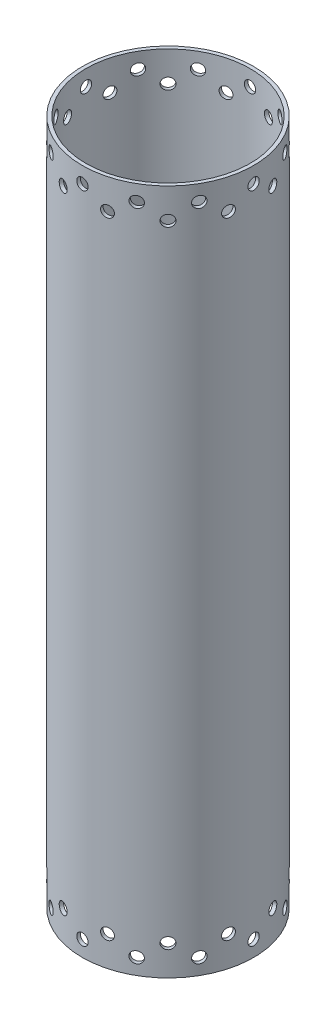
from build123d import *

# Parameters (mm, degrees)
SKETCH2_R                = 76.2
SKETCH2_R_2              = 73.025
BOSS_EXTRUDE1_DEPTH      = 609.6
SKETCH3_R                = 5.0419
CUT_EXTRUDE1_DEPTH       = 1143
SKETCH6_R                = 5.0419
CUT_EXTRUDE2_DEPTH       = 25.4
CIRPATTERN2_COUNT        = 12
MIRROR1_COPY_1_SKETCH_R  = 5.0419
MIRROR1_COPY_1_DEPTH     = 1143
MIRROR1_COPY_2_SKETCH_R  = 5.0419
MIRROR1_COPY_2_DEPTH     = 1143
MIRROR1_COPY_3_SKETCH_R  = 5.0419
MIRROR1_COPY_3_DEPTH     = 1143
MIRROR1_COPY_4_SKETCH_R  = 5.0419
MIRROR1_COPY_4_DEPTH     = 1143
MIRROR1_COPY_5_SKETCH_R  = 5.0419
MIRROR1_COPY_5_DEPTH     = 1143
MIRROR1_COPY_6_SKETCH_R  = 5.0419
MIRROR1_COPY_6_DEPTH     = 1143
MIRROR1_COPY_7_SKETCH_R  = 5.0419
MIRROR1_COPY_7_DEPTH     = 1143
MIRROR1_COPY_8_SKETCH_R  = 5.0419
MIRROR1_COPY_8_DEPTH     = 1143
MIRROR1_COPY_9_SKETCH_R  = 5.0419
MIRROR1_COPY_9_DEPTH     = 1143
MIRROR1_COPY_10_SKETCH_R = 5.0419
MIRROR1_COPY_10_DEPTH    = 1143
MIRROR1_COPY_11_SKETCH_R = 5.0419
MIRROR1_COPY_11_DEPTH    = 1143
MIRROR1_COPY_12_SKETCH_R = 5.0419
MIRROR1_COPY_12_DEPTH    = 25.4
MIRROR1_COPY_13_SKETCH_R = 5.0419
MIRROR1_COPY_13_DEPTH    = 25.4
MIRROR1_COPY_14_SKETCH_R = 5.0419
MIRROR1_COPY_14_DEPTH    = 25.4
MIRROR1_COPY_15_SKETCH_R = 5.0419
MIRROR1_COPY_15_DEPTH    = 25.4
MIRROR1_COPY_16_SKETCH_R = 5.0419
MIRROR1_COPY_16_DEPTH    = 25.4
MIRROR1_COPY_17_SKETCH_R = 5.0419
MIRROR1_COPY_17_DEPTH    = 25.4
MIRROR1_COPY_18_SKETCH_R = 5.0419
MIRROR1_COPY_18_DEPTH    = 25.4
MIRROR1_COPY_19_SKETCH_R = 5.0419
MIRROR1_COPY_19_DEPTH    = 25.4
MIRROR1_COPY_20_SKETCH_R = 5.0419
MIRROR1_COPY_20_DEPTH    = 25.4
MIRROR1_COPY_21_SKETCH_R = 5.0419
MIRROR1_COPY_21_DEPTH    = 25.4
MIRROR1_COPY_22_SKETCH_R = 5.0419
MIRROR1_COPY_22_DEPTH    = 25.4
MIRROR1_COPY_23_SKETCH_R = 5.0419
MIRROR1_COPY_23_DEPTH    = 1143
MIRROR1_COPY_24_SKETCH_R = 5.0419
MIRROR1_COPY_24_DEPTH    = 25.4


with BuildPart() as part:
    # Sketch2 → Boss-Extrude1 (new body)
    with BuildSketch(Plane(origin=(0, 0, 0), x_dir=(1, 0, 0), z_dir=(0, 1, 0))):
        Circle(SKETCH2_R)
        Circle(SKETCH2_R_2, mode=Mode.SUBTRACT)
    extrude(amount=BOSS_EXTRUDE1_DEPTH)

    # Sketch3 → Cut-Extrude1 (cut)
    with BuildSketch(Plane.XY):
        with Locations((0, 595.503)):
            Circle(SKETCH3_R)
    cut_extrude1 = extrude(amount=-CUT_EXTRUDE1_DEPTH, mode=Mode.SUBTRACT)

    # Sketch6 → Cut-Extrude2 (cut)
    with BuildSketch(Plane(origin=(-19.722011237, 0, 73.603547963), x_dir=(0, -1, 0), z_dir=(-0.25881904510252135, 0, 0.9659258262890681))):
        with Locations((-582.803, 0)):
            Circle(SKETCH6_R)
    cut_extrude2 = extrude(amount=-CUT_EXTRUDE2_DEPTH, mode=Mode.SUBTRACT)

    # CirPattern2: Cut-Extrude1, Cut-Extrude2 ×12 about axis
    cirpattern2_axis = Axis((0, 609.6, 0), (0, -1, 0))
    add([cut_extrude1.rotate(cirpattern2_axis, i * 360 / CIRPATTERN2_COUNT) for i in range(1, CIRPATTERN2_COUNT)], mode=Mode.SUBTRACT)
    add([cut_extrude2.rotate(cirpattern2_axis, i * 360 / CIRPATTERN2_COUNT) for i in range(1, CIRPATTERN2_COUNT)], mode=Mode.SUBTRACT)

    # Mirror1 copy 1 sketch → Mirror1 copy 1 (cut)
    with BuildSketch(Plane(origin=(0, 609.6, 0), x_dir=(0.8660254037844387, 0, 0.49999999999999994), z_dir=(-0.49999999999999994, 0, 0.8660254037844387))):
        with Locations((0, -595.503)):
            Circle(MIRROR1_COPY_1_SKETCH_R)
    extrude(amount=-MIRROR1_COPY_1_DEPTH, mode=Mode.SUBTRACT)

    # Mirror1 copy 2 sketch → Mirror1 copy 2 (cut)
    with BuildSketch(Plane(origin=(0, 609.6, 0), x_dir=(0.5000000000000001, 0, 0.8660254037844386), z_dir=(-0.8660254037844386, 0, 0.5000000000000001))):
        with Locations((0, -595.503)):
            Circle(MIRROR1_COPY_2_SKETCH_R)
    extrude(amount=-MIRROR1_COPY_2_DEPTH, mode=Mode.SUBTRACT)

    # Mirror1 copy 3 sketch → Mirror1 copy 3 (cut)
    with BuildSketch(Plane(origin=(0, 609.6, 0), x_dir=(0, 0, 1), z_dir=(-1, 0, 0))):
        with Locations((0, -595.503)):
            Circle(MIRROR1_COPY_3_SKETCH_R)
    extrude(amount=-MIRROR1_COPY_3_DEPTH, mode=Mode.SUBTRACT)

    # Mirror1 copy 4 sketch → Mirror1 copy 4 (cut)
    with BuildSketch(Plane(origin=(0, 609.6, 0), x_dir=(-0.4999999999999998, 0, 0.8660254037844387), z_dir=(-0.8660254037844387, 0, -0.4999999999999998))):
        with Locations((0, -595.503)):
            Circle(MIRROR1_COPY_4_SKETCH_R)
    extrude(amount=-MIRROR1_COPY_4_DEPTH, mode=Mode.SUBTRACT)

    # Mirror1 copy 5 sketch → Mirror1 copy 5 (cut)
    with BuildSketch(Plane(origin=(0, 609.6, 0), x_dir=(-0.8660254037844387, 0, 0.49999999999999994), z_dir=(-0.49999999999999994, 0, -0.8660254037844387))):
        with Locations((0, -595.503)):
            Circle(MIRROR1_COPY_5_SKETCH_R)
    extrude(amount=-MIRROR1_COPY_5_DEPTH, mode=Mode.SUBTRACT)

    # Mirror1 copy 6 sketch → Mirror1 copy 6 (cut)
    with BuildSketch(Plane(origin=(0, 609.6, 0), x_dir=(-1, 0, 0), z_dir=(0, 0, -1))):
        with Locations((0, -595.503)):
            Circle(MIRROR1_COPY_6_SKETCH_R)
    extrude(amount=-MIRROR1_COPY_6_DEPTH, mode=Mode.SUBTRACT)

    # Mirror1 copy 7 sketch → Mirror1 copy 7 (cut)
    with BuildSketch(Plane(origin=(0, 609.6, 0), x_dir=(-0.8660254037844386, 0, -0.5000000000000001), z_dir=(0.5000000000000001, 0, -0.8660254037844386))):
        with Locations((0, -595.503)):
            Circle(MIRROR1_COPY_7_SKETCH_R)
    extrude(amount=-MIRROR1_COPY_7_DEPTH, mode=Mode.SUBTRACT)

    # Mirror1 copy 8 sketch → Mirror1 copy 8 (cut)
    with BuildSketch(Plane(origin=(0, 609.6, 0), x_dir=(-0.5000000000000004, 0, -0.8660254037844384), z_dir=(0.8660254037844384, 0, -0.5000000000000004))):
        with Locations((0, -595.503)):
            Circle(MIRROR1_COPY_8_SKETCH_R)
    extrude(amount=-MIRROR1_COPY_8_DEPTH, mode=Mode.SUBTRACT)

    # Mirror1 copy 9 sketch → Mirror1 copy 9 (cut)
    with BuildSketch(Plane(origin=(0, 609.6, 0), x_dir=(0, 0, -1), z_dir=(1, 0, 0))):
        with Locations((0, -595.503)):
            Circle(MIRROR1_COPY_9_SKETCH_R)
    extrude(amount=-MIRROR1_COPY_9_DEPTH, mode=Mode.SUBTRACT)

    # Mirror1 copy 10 sketch → Mirror1 copy 10 (cut)
    with BuildSketch(Plane(origin=(0, 609.6, 0), x_dir=(0.5000000000000001, 0, -0.8660254037844386), z_dir=(0.8660254037844386, 0, 0.5000000000000001))):
        with Locations((0, -595.503)):
            Circle(MIRROR1_COPY_10_SKETCH_R)
    extrude(amount=-MIRROR1_COPY_10_DEPTH, mode=Mode.SUBTRACT)

    # Mirror1 copy 11 sketch → Mirror1 copy 11 (cut)
    with BuildSketch(Plane(origin=(0, 609.6, 0), x_dir=(0.8660254037844384, 0, -0.5000000000000004), z_dir=(0.5000000000000004, 0, 0.8660254037844384))):
        with Locations((0, -595.503)):
            Circle(MIRROR1_COPY_11_SKETCH_R)
    extrude(amount=-MIRROR1_COPY_11_DEPTH, mode=Mode.SUBTRACT)

    # Mirror1 copy 12 sketch → Mirror1 copy 12 (cut)
    with BuildSketch(Plane(origin=(-53.881536726, 609.6, 53.881536726), x_dir=(0, 1, 0), z_dir=(-0.7071067811865479, 0, 0.7071067811865472))):
        with Locations((-582.803, 0)):
            Circle(MIRROR1_COPY_12_SKETCH_R)
    extrude(amount=-MIRROR1_COPY_12_DEPTH, mode=Mode.SUBTRACT)

    # Mirror1 copy 13 sketch → Mirror1 copy 13 (cut)
    with BuildSketch(Plane(origin=(-73.603547963, 609.6, 19.722011237), x_dir=(0, 1, 0), z_dir=(-0.9659258262890684, 0, 0.2588190451025203))):
        with Locations((-582.803, 0)):
            Circle(MIRROR1_COPY_13_SKETCH_R)
    extrude(amount=-MIRROR1_COPY_13_DEPTH, mode=Mode.SUBTRACT)

    # Mirror1 copy 14 sketch → Mirror1 copy 14 (cut)
    with BuildSketch(Plane(origin=(-73.603547963, 609.6, -19.722011237), x_dir=(0, 1, 0), z_dir=(-0.9659258262890681, 0, -0.2588190451025213))):
        with Locations((-582.803, 0)):
            Circle(MIRROR1_COPY_14_SKETCH_R)
    extrude(amount=-MIRROR1_COPY_14_DEPTH, mode=Mode.SUBTRACT)

    # Mirror1 copy 15 sketch → Mirror1 copy 15 (cut)
    with BuildSketch(Plane(origin=(-53.881536726, 609.6, -53.881536726), x_dir=(0, 1, 0), z_dir=(-0.7071067811865472, 0, -0.7071067811865477))):
        with Locations((-582.803, 0)):
            Circle(MIRROR1_COPY_15_SKETCH_R)
    extrude(amount=-MIRROR1_COPY_15_DEPTH, mode=Mode.SUBTRACT)

    # Mirror1 copy 16 sketch → Mirror1 copy 16 (cut)
    with BuildSketch(Plane(origin=(-19.722011237, 609.6, -73.603547963), x_dir=(0, 1, 0), z_dir=(-0.2588190451025201, 0, -0.9659258262890684))):
        with Locations((-582.803, 0)):
            Circle(MIRROR1_COPY_16_SKETCH_R)
    extrude(amount=-MIRROR1_COPY_16_DEPTH, mode=Mode.SUBTRACT)

    # Mirror1 copy 17 sketch → Mirror1 copy 17 (cut)
    with BuildSketch(Plane(origin=(19.722011237, 609.6, -73.603547963), x_dir=(0, 1, 0), z_dir=(0.25881904510252124, 0, -0.9659258262890681))):
        with Locations((-582.803, 0)):
            Circle(MIRROR1_COPY_17_SKETCH_R)
    extrude(amount=-MIRROR1_COPY_17_DEPTH, mode=Mode.SUBTRACT)

    # Mirror1 copy 18 sketch → Mirror1 copy 18 (cut)
    with BuildSketch(Plane(origin=(53.881536726, 609.6, -53.881536726), x_dir=(0, 1, 0), z_dir=(0.707106781186548, 0, -0.707106781186547))):
        with Locations((-582.803, 0)):
            Circle(MIRROR1_COPY_18_SKETCH_R)
    extrude(amount=-MIRROR1_COPY_18_DEPTH, mode=Mode.SUBTRACT)

    # Mirror1 copy 19 sketch → Mirror1 copy 19 (cut)
    with BuildSketch(Plane(origin=(73.603547963, 609.6, -19.722011237), x_dir=(0, 1, 0), z_dir=(0.9659258262890683, 0, -0.25881904510252063))):
        with Locations((-582.803, 0)):
            Circle(MIRROR1_COPY_19_SKETCH_R)
    extrude(amount=-MIRROR1_COPY_19_DEPTH, mode=Mode.SUBTRACT)

    # Mirror1 copy 20 sketch → Mirror1 copy 20 (cut)
    with BuildSketch(Plane(origin=(73.603547963, 609.6, 19.722011237), x_dir=(0, 1, 0), z_dir=(0.9659258262890681, 0, 0.2588190451025212))):
        with Locations((-582.803, 0)):
            Circle(MIRROR1_COPY_20_SKETCH_R)
    extrude(amount=-MIRROR1_COPY_20_DEPTH, mode=Mode.SUBTRACT)

    # Mirror1 copy 21 sketch → Mirror1 copy 21 (cut)
    with BuildSketch(Plane(origin=(53.881536726, 609.6, 53.881536726), x_dir=(0, 1, 0), z_dir=(0.707106781186547, 0, 0.707106781186548))):
        with Locations((-582.803, 0)):
            Circle(MIRROR1_COPY_21_SKETCH_R)
    extrude(amount=-MIRROR1_COPY_21_DEPTH, mode=Mode.SUBTRACT)

    # Mirror1 copy 22 sketch → Mirror1 copy 22 (cut)
    with BuildSketch(Plane(origin=(19.722011237, 609.6, 73.603547963), x_dir=(0, 1, 0), z_dir=(0.25881904510252063, 0, 0.9659258262890683))):
        with Locations((-582.803, 0)):
            Circle(MIRROR1_COPY_22_SKETCH_R)
    extrude(amount=-MIRROR1_COPY_22_DEPTH, mode=Mode.SUBTRACT)

    # Mirror1 copy 23 sketch → Mirror1 copy 23 (cut)
    with BuildSketch(Plane(origin=(0, 609.6, 0), x_dir=(1, 0, 0), z_dir=(0, 0, 1))):
        with Locations((0, -595.503)):
            Circle(MIRROR1_COPY_23_SKETCH_R)
    extrude(amount=-MIRROR1_COPY_23_DEPTH, mode=Mode.SUBTRACT)

    # Mirror1 copy 24 sketch → Mirror1 copy 24 (cut)
    with BuildSketch(Plane(origin=(-19.722011237, 609.6, 73.603547963), x_dir=(0, 1, 0), z_dir=(-0.25881904510252135, 0, 0.9659258262890681))):
        with Locations((-582.803, 0)):
            Circle(MIRROR1_COPY_24_SKETCH_R)
    extrude(amount=-MIRROR1_COPY_24_DEPTH, mode=Mode.SUBTRACT)


solid = part.part
